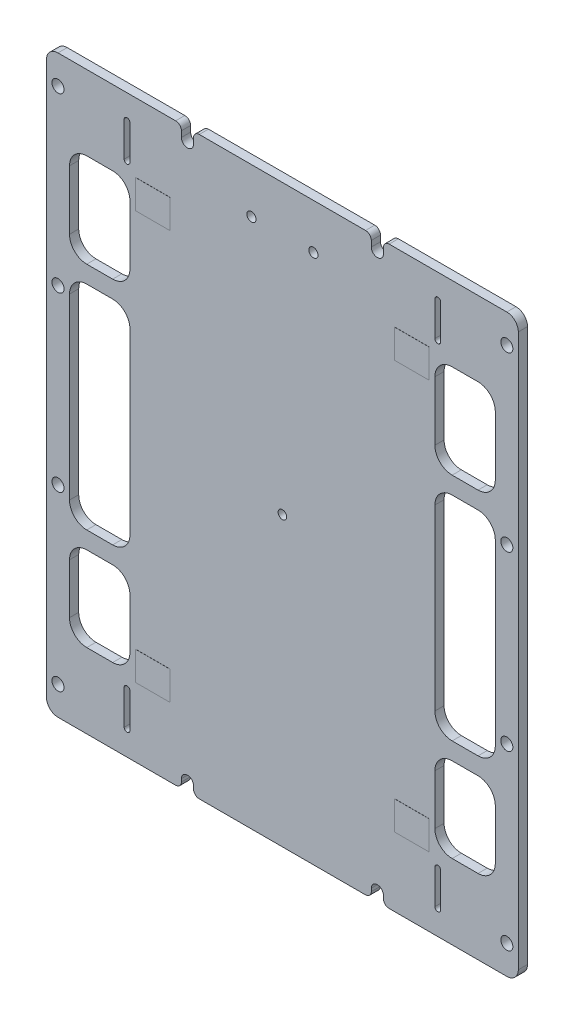
from build123d import *

# Parameters (mm, degrees)
BOARDOUTLINE_DEPTH          = 1.6
SKETCH2_R                   = 0.75
SKETCH2_R_2                 = 0.8
COMPONENTHOLES_DEPTH        = 65.680445267
SOLARCELLCONTACTHOLES_DEPTH = 1.6
WINDOWS_1SIDE_DEPTH         = 65.680445267
SKETCH5_W                   = 6
SKETCH5_H                   = 5
CONTACTPADS_DEPTH           = 0.02
M2_CLEARANCE_HOLE1_D        = 2.1
CUT_EXTRUDE1_DEPTH          = 65.680943098
FILLET3_R                   = 1
FILLET3_OF_MIRROR1_R        = 1


with BuildPart() as part:
    # Sketch1 → boardOutline (new body)
    with BuildSketch(Plane.XY):
        with BuildLine():
            Line((-39, -50), (39, -50))
            ThreePointArc((39, -50), (40.414213562, -49.414213562), (41, -48))
            Line((41, -48), (41, 48))
            ThreePointArc((41, 48), (40.414213562, 49.414213562), (39, 50))
            Line((39, 50), (-39, 50))
            ThreePointArc((-39, 50), (-40.414213562, 49.414213562), (-41, 48))
            Line((-41, 48), (-41, -48))
            ThreePointArc((-41, -48), (-40.414213562, -49.414213562), (-39, -50))
        make_face()
    extrude(amount=BOARDOUTLINE_DEPTH)

    # Sketch2 → componentHoles (cut, through all)
    with BuildSketch(Plane.XY.offset(1.6)):
        Circle(SKETCH2_R)
        with Locations((-5.38, 42.15)):
            Circle(SKETCH2_R_2)
        with Locations((5.39, 42.15)):
            Circle(SKETCH2_R_2)
    extrude(amount=-COMPONENTHOLES_DEPTH, mode=Mode.SUBTRACT)

    # Sketch4 → solarCellContactHoles (cut)
    with BuildSketch(Plane.XY.offset(1.6)):
        with BuildLine():
            Line((-27.5, 39.75), (-27.5, 45.75))
            ThreePointArc((-27.5, 45.75), (-27, 46.25), (-26.5, 45.75))
            Line((-26.5, 45.75), (-26.5, 39.75))
            ThreePointArc((-26.5, 39.75), (-27, 39.25), (-27.5, 39.75))
        make_face()
        with BuildLine():
            Line((26.5, 39.75), (26.5, 45.75))
            ThreePointArc((26.5, 45.75), (27, 46.25), (27.5, 45.75))
            Line((27.5, 45.75), (27.5, 39.75))
            ThreePointArc((27.5, 39.75), (27, 39.25), (26.5, 39.75))
        make_face()
        with BuildLine():
            Line((26.5, -45.75), (26.5, -39.75))
            ThreePointArc((26.5, -39.75), (27, -39.25), (27.5, -39.75))
            Line((27.5, -39.75), (27.5, -45.75))
            ThreePointArc((27.5, -45.75), (27, -46.25), (26.5, -45.75))
        make_face()
        with BuildLine():
            Line((-27.5, -45.75), (-27.5, -39.75))
            ThreePointArc((-27.5, -39.75), (-27, -39.25), (-26.5, -39.75))
            Line((-26.5, -39.75), (-26.5, -45.75))
            ThreePointArc((-26.5, -45.75), (-27, -46.25), (-27.5, -45.75))
        make_face()
    extrude(amount=-SOLARCELLCONTACTHOLES_DEPTH, mode=Mode.SUBTRACT)

    # Sketch3 → windows_1side (cut, through all)
    with BuildSketch(Plane.XY.offset(1.6)):
        with BuildLine():
            Line((-34, 37), (-29.5, 37))
            ThreePointArc((-29.5, 37), (-27.378679656, 36.121320344), (-26.5, 34))
            Line((-26.5, 34), (-26.5, 23.7))
            ThreePointArc((-26.5, 23.7), (-27.378679656, 21.578679656), (-29.5, 20.7))
            Line((-29.5, 20.7), (-34, 20.7))
            ThreePointArc((-34, 20.7), (-36.121320344, 21.578679656), (-37, 23.7))
            Line((-37, 23.7), (-37, 34))
            ThreePointArc((-37, 34), (-36.121320344, 36.121320344), (-34, 37))
        make_face()
        with BuildLine():
            Line((-29.5, -22.3), (-34, -22.3))
            ThreePointArc((-34, -22.3), (-36.121320344, -23.178679656), (-37, -25.3))
            Line((-37, -25.3), (-37, -34))
            ThreePointArc((-37, -34), (-36.121320344, -36.121320344), (-34, -37))
            Line((-34, -37), (-29.5, -37))
            ThreePointArc((-29.5, -37), (-27.378679656, -36.121320344), (-26.5, -34))
            Line((-26.5, -34), (-26.5, -25.3))
            ThreePointArc((-26.5, -25.3), (-27.378679656, -23.178679656), (-29.5, -22.3))
        make_face()
        with BuildLine():
            Line((-29.5, -19.3), (-34, -19.3))
            ThreePointArc((-34, -19.3), (-36.121320344, -18.421320344), (-37, -16.3))
            Line((-37, -16.3), (-37, 14.7))
            ThreePointArc((-37, 14.7), (-36.121320344, 16.821320344), (-34, 17.7))
            Line((-34, 17.7), (-29.5, 17.7))
            ThreePointArc((-29.5, 17.7), (-27.378679656, 16.821320344), (-26.5, 14.7))
            Line((-26.5, 14.7), (-26.5, -16.3))
            ThreePointArc((-26.5, -16.3), (-27.378679656, -18.421320344), (-29.5, -19.3))
        make_face()
    windows_1side = extrude(amount=-WINDOWS_1SIDE_DEPTH, mode=Mode.SUBTRACT)

    # Sketch5 → contactPads (add)
    with BuildSketch(Plane.XY.offset(1.6)):
        with Locations((-22.5, 35.5)):
            Rectangle(SKETCH5_W, SKETCH5_H)
        with Locations((22.5, 35.5)):
            Rectangle(SKETCH5_W, SKETCH5_H)
        with Locations((22.5, -35.5)):
            Rectangle(SKETCH5_W, SKETCH5_H)
        with Locations((-22.5, -35.5)):
            Rectangle(SKETCH5_W, SKETCH5_H)
    extrude(amount=CONTACTPADS_DEPTH)

    # M2 Clearance Hole1 (through all)
    with Locations(Plane(origin=(0, 0, 0), x_dir=(-1, 0, 0), z_dir=(0, 0, -1))):
        with Locations((39, 45), (39, -15), (39, -45), (39, 15)):
            m2_clearance_hole1 = Hole(M2_CLEARANCE_HOLE1_D / 2)

    # Sketch10 → Cut-Extrude1 (cut, symmetric)
    with BuildSketch(Plane(origin=(0, 0, 0), x_dir=(-1, 0, 0), z_dir=(0, 0, -1))):
        with BuildLine():
            Line((15.45, 48), (15.45, 55.073166109))
            ThreePointArc((15.45, 55.073166109), (16.5, 56.123166109), (17.55, 55.073166109))
            Line((17.55, 55.073166109), (17.55, 48))
            ThreePointArc((17.55, 48), (16.5, 46.95), (15.45, 48))
        make_face()
        with BuildLine():
            Line((17.55, -48.5), (17.55, -55.573166109))
            ThreePointArc((17.55, -55.573166109), (16.5, -56.623166109), (15.45, -55.573166109))
            Line((15.45, -55.573166109), (15.45, -48.5))
            ThreePointArc((15.45, -48.5), (16.5, -47.45), (17.55, -48.5))
        make_face()
    cut_extrude1 = extrude(amount=CUT_EXTRUDE1_DEPTH, both=True, mode=Mode.SUBTRACT)

    # Fillet3
    fillet3_edges = [part.edges().sort_by_distance(p)[0] for p in [
        (-17.55, 50, 0.8),
        (-15.45, 50, 0.8),
        (-15.45, -50, 0.8),
        (-17.55, -50, 0.8),
    ]]
    fillet(fillet3_edges, radius=FILLET3_R)

    # Mirror1: windows_1side, M2 Clearance Hole1, Cut-Extrude1 across plane
    add(windows_1side.mirror(Plane(origin=(0, 0, 0), x_dir=(0, 0, 1), z_dir=(1, 0, 0))), mode=Mode.SUBTRACT)
    add(m2_clearance_hole1.mirror(Plane(origin=(0, 0, 0), x_dir=(0, 0, 1), z_dir=(1, 0, 0))), mode=Mode.SUBTRACT)
    add(cut_extrude1.mirror(Plane(origin=(0, 0, 0), x_dir=(0, 0, 1), z_dir=(1, 0, 0))), mode=Mode.SUBTRACT)

    # Fillet3 of Mirror1
    fillet3_of_mirror1_edges = [part.edges().sort_by_distance(p)[0] for p in [
        (17.55, 50, 0.8),
        (15.45, 50, 0.8),
        (15.45, -50, 0.8),
        (17.55, -50, 0.8),
    ]]
    fillet(fillet3_of_mirror1_edges, radius=FILLET3_OF_MIRROR1_R)


solid = part.part
